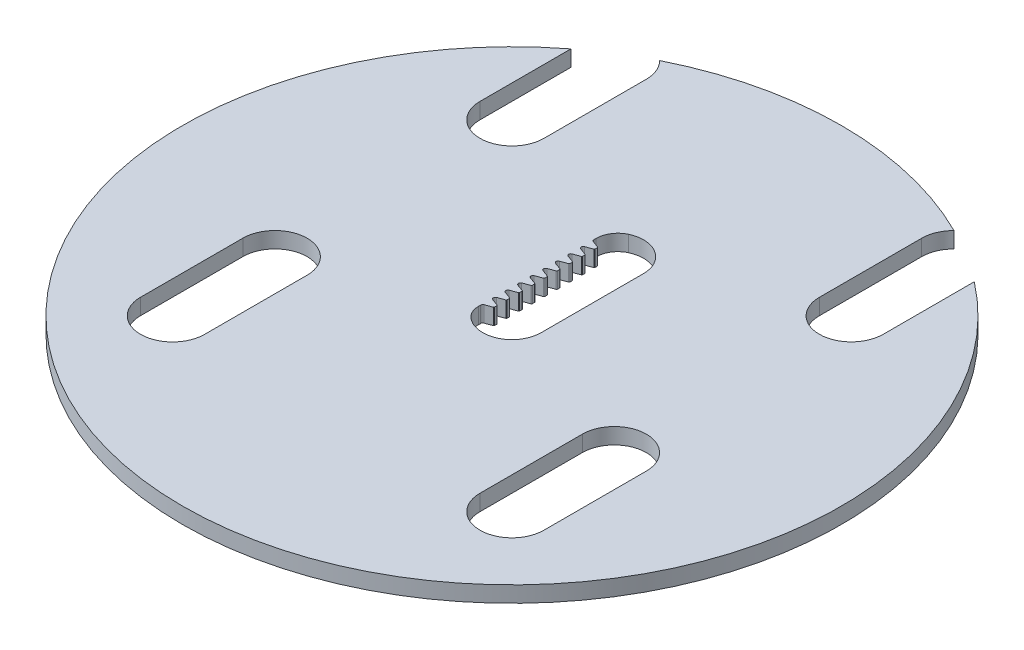
from build123d import *

# Parameters (mm, degrees)
BOSS_EXTRUDE1_DEPTH = 3.175
BOSS_EXTRUDE3_START = -3.175
BOSS_EXTRUDE3_DEPTH = 3.175


# Read off the part's stored shape, not the designer's step: Boss-Extrude3
with BuildPart() as part:
    # Sketch3 → Boss-Extrude1 (new body)
    with BuildSketch(Plane.XZ):
        with BuildLine():
            ThreePointArc((65.405, 0), (-28.808992359, 58.718446712), (-40.025960454, -51.727521831))
            Line((-40.025960454, -51.727521831), (-40.025960454, -33.675960454))
            ThreePointArc((-40.025960454, -33.675960454), (-33.675960454, -27.325960454), (-27.325960454, -33.675960454))
            Line((-27.325960454, -33.675960454), (-27.325960454, -53.995960454))
            ThreePointArc((-27.325960454, -53.995960454), (-27.817666914, -56.446041432), (-29.21663661, -58.516682836))
            ThreePointArc((-29.21663661, -58.516682836), (0, -65.405), (29.21663661, -58.516682836))
            ThreePointArc((29.21663661, -58.516682836), (27.817666914, -56.446041432), (27.325960454, -53.995960454))
            Line((27.325960454, -53.995960454), (27.325960454, -33.675960454))
            ThreePointArc((27.325960454, -33.675960454), (33.675960454, -27.325960454), (40.025960454, -33.675960454))
            Line((40.025960454, -33.675960454), (40.025960454, -51.727521831))
            ThreePointArc((40.025960454, -51.727521831), (58.718446712, -28.808992359), (65.405, 0))
        make_face()
        with BuildLine():
            ThreePointArc((-5.8, 0), (0, 5.8), (5.8, 0))
            Line((5.8, 0), (5.8, -20.32))
            ThreePointArc((5.8, -20.32), (0, -26.12), (-5.8, -20.32))
            Line((-5.8, -20.32), (-5.8, 0))
        make_face(mode=Mode.SUBTRACT)
        with BuildLine():
            ThreePointArc((-27.305960454, 13.355960454), (-33.675960454, 6.985960454), (-40.045960454, 13.355960454))
            Line((-40.045960454, 13.355960454), (-40.045960454, 33.675960454))
            ThreePointArc((-40.045960454, 33.675960454), (-33.675960454, 40.045960454), (-27.305960454, 33.675960454))
            Line((-27.305960454, 33.675960454), (-27.305960454, 13.355960454))
        make_face(mode=Mode.SUBTRACT)
        with BuildLine():
            ThreePointArc((40.025960454, 13.355960454), (33.675960454, 7.005960454), (27.325960454, 13.355960454))
            Line((27.325960454, 13.355960454), (27.325960454, 33.675960454))
            ThreePointArc((27.325960454, 33.675960454), (33.675960454, 40.025960454), (40.025960454, 33.675960454))
            Line((40.025960454, 33.675960454), (40.025960454, 13.355960454))
        make_face(mode=Mode.SUBTRACT)
    extrude(amount=BOSS_EXTRUDE1_DEPTH)

    # Boss-Extrude3 outline → Boss-Extrude3 (add)
    with BuildSketch(Plane(origin=(0, 0, 0), x_dir=(1, 0, 0), z_dir=(0, 1, 0)).offset(BOSS_EXTRUDE3_START)):
        with BuildLine():
            Line((-4.952891864, -1.691319584), (-4.952891864, -1.246819584))
            ThreePointArc((-4.952891864, -1.246819584), (-4.879618202, -1.014425219), (-4.6863, -0.866086946))
            Line((-4.6863, -0.866086946), (-3.328347771, -0.371832755))
            ThreePointArc((-3.328347771, -0.371832755), (-3.253985597, -0.314772651), (-3.2258, -0.22537936))
            Line((-3.2258, -0.22537936), (-3.2258, 0.22537936))
            ThreePointArc((-3.2258, 0.22537936), (-3.253985597, 0.314772651), (-3.328347771, 0.371832755))
            Line((-3.328347771, 0.371832755), (-4.6863, 0.866086946))
            ThreePointArc((-4.6863, 0.866086946), (-4.952891864, 1.246819585), (-4.6863, 1.627552223))
            Line((-4.6863, 1.627552223), (-3.328347771, 2.121806414))
            ThreePointArc((-3.328347771, 2.121806414), (-3.253985597, 2.178866518), (-3.2258, 2.268259809))
            Line((-3.2258, 2.268259809), (-3.2258, 2.719018529))
            ThreePointArc((-3.2258, 2.719018529), (-3.253985597, 2.80841182), (-3.328347771, 2.865471924))
            Line((-3.328347771, 2.865471924), (-4.6863, 3.359726115))
            ThreePointArc((-4.6863, 3.359726115), (-4.952891864, 3.740458754), (-4.6863, 4.121191392))
            Line((-4.6863, 4.121191392), (-3.328347771, 4.615445582))
            ThreePointArc((-3.328347771, 4.615445582), (-3.253985597, 4.672505686), (-3.2258, 4.761898978))
            Line((-3.2258, 4.761898978), (-3.2258, 5.212657697))
            ThreePointArc((-3.2258, 5.212657697), (-3.253985597, 5.302050989), (-3.328347771, 5.359111093))
            Line((-3.328347771, 5.359111093), (-4.6863, 5.853365283))
            ThreePointArc((-4.6863, 5.853365283), (-4.952891864, 6.234097921), (-4.6863, 6.61483056))
            Line((-4.6863, 6.61483056), (-3.328347771, 7.109084751))
            ThreePointArc((-3.328347771, 7.109084751), (-3.253985597, 7.166144855), (-3.2258, 7.255538147))
            Line((-3.2258, 7.255538147), (-3.2258, 7.706296866))
            ThreePointArc((-3.2258, 7.706296866), (-3.253985597, 7.795690157), (-3.328347771, 7.852750261))
            Line((-3.328347771, 7.852750261), (-4.6863, 8.347004452))
            ThreePointArc((-4.6863, 8.347004452), (-4.952891864, 8.72773709), (-4.6863, 9.108469729))
            Line((-4.6863, 9.108469729), (-3.328347771, 9.60272392))
            ThreePointArc((-3.328347771, 9.60272392), (-3.253985597, 9.659784024), (-3.2258, 9.749177315))
            Line((-3.2258, 9.749177315), (-3.2258, 10.199936035))
            ThreePointArc((-3.2258, 10.199936035), (-3.253985597, 10.289329326), (-3.328347771, 10.34638943))
            Line((-3.328347771, 10.34638943), (-4.6863, 10.840643621))
            ThreePointArc((-4.6863, 10.840643621), (-4.952891864, 11.221376259), (-4.6863, 11.602108898))
            Line((-4.6863, 11.602108898), (-3.328347771, 12.096363089))
            ThreePointArc((-3.328347771, 12.096363089), (-3.253985597, 12.153423193), (-3.2258, 12.242816484))
            Line((-3.2258, 12.242816484), (-3.2258, 12.693575204))
            ThreePointArc((-3.2258, 12.693575204), (-3.253985597, 12.782968495), (-3.328347771, 12.840028599))
            Line((-3.328347771, 12.840028599), (-4.6863, 13.33428279))
            ThreePointArc((-4.6863, 13.33428279), (-4.952891864, 13.715015428), (-4.6863, 14.095748067))
            Line((-4.6863, 14.095748067), (-3.328347771, 14.590002258))
            ThreePointArc((-3.328347771, 14.590002258), (-3.253985597, 14.647062362), (-3.2258, 14.736455653))
            Line((-3.2258, 14.736455653), (-3.2258, 15.187214372))
            ThreePointArc((-3.2258, 15.187214372), (-3.253985597, 15.276607664), (-3.328347771, 15.333667768))
            Line((-3.328347771, 15.333667768), (-4.6863, 15.827921959))
            ThreePointArc((-4.6863, 15.827921959), (-4.952891864, 16.208654598), (-4.6863, 16.589387236))
            Line((-4.6863, 16.589387236), (-3.328347771, 17.083641426))
            ThreePointArc((-3.328347771, 17.083641426), (-3.253985597, 17.14070153), (-3.2258, 17.230094822))
            Line((-3.2258, 17.230094822), (-3.2258, 17.680853541))
            ThreePointArc((-3.2258, 17.680853541), (-3.253985597, 17.770246833), (-3.328347771, 17.827306937))
            Line((-3.328347771, 17.827306937), (-4.6863, 18.321561127))
            ThreePointArc((-4.6863, 18.321561127), (-4.952891864, 18.702293766), (-4.6863, 19.083026404))
            Line((-4.6863, 19.083026404), (-3.328347771, 19.577280595))
            ThreePointArc((-3.328347771, 19.577280595), (-3.253985597, 19.634340699), (-3.2258, 19.723733991))
            Line((-3.2258, 19.723733991), (-3.2258, 20.17449271))
            ThreePointArc((-3.2258, 20.17449271), (-3.253985597, 20.263886001), (-3.328347771, 20.320946105))
            Line((-3.328347771, 20.320946105), (-4.6863, 20.815200296))
            ThreePointArc((-4.6863, 20.815200296), (-4.879618202, 20.96353857), (-4.952891864, 21.195932935))
            Line((-4.952891864, 21.195932935), (-4.952891864, 21.640432935))
            ThreePointArc((-4.952891864, 21.640432935), (-4.26463583, 23.987869264), (-2.41779287, 25.592027849))
            ThreePointArc((-2.41779287, 25.592027849), (-4.881761908, 23.45183663), (-5.8, 20.32))
            Line((-5.8, 20.32), (-5.8, 0))
            ThreePointArc((-5.8, 0), (-5.240594871, -2.485189209), (-3.670287792, -4.490989593))
            Line((-3.670287792, -4.490989593), (-3.662076811, -4.493978146))
            ThreePointArc((-3.662076811, -4.493978146), (-4.614680156, -3.234133451), (-4.952891864, -1.691319584))
        make_face()
    extrude(amount=BOSS_EXTRUDE3_DEPTH)


solid = part.part
